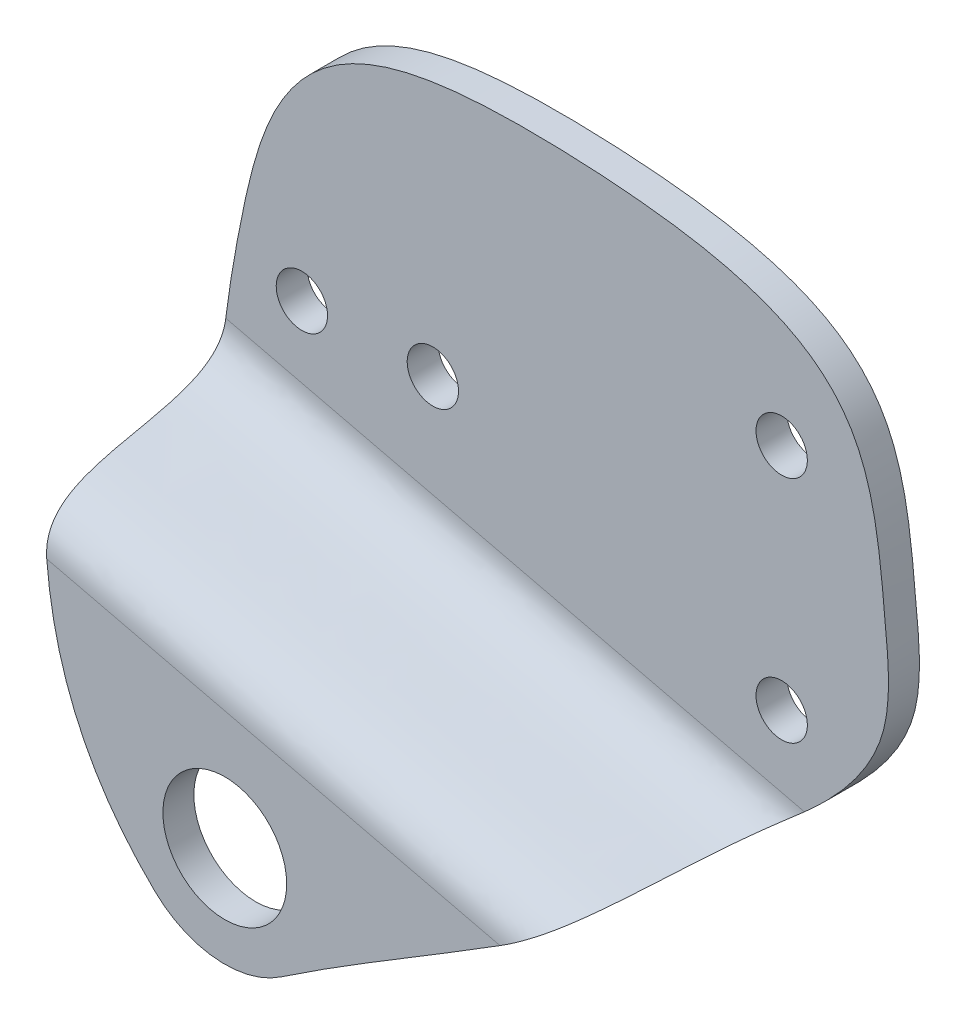
from build123d import *

# Parameters (mm, degrees)
MAIN_FEATURES_SKETCH_R   = 6
MAIN_FEATURES_SKETCH_R_2 = 2.4892
BOSS_EXTRUDE1_DEPTH      = 20
CUT_EXTRUDE1_DEPTH       = 81.169963393
CUT_EXTRUDE1_DEPTH_BACK  = 81.169963393


with BuildPart() as part:
    # main_features_sketch → Boss-Extrude1 (new body)
    with BuildSketch(Plane.XY):
        with BuildLine():
            ThreePointArc((-6.758273113, -14.327677037), (-0.830819524, -17.014537504), (5.466795464, -15.373205519))
            add(Edge.make_bspline(
                [(-6.758273113, -14.327677037), (-19.815407904, -1.771083652), (-17.868094073, 18.374574848), (-11.559395694, 47.113885006), (0.771302016, 51.653694953), (45.134222968, 49.048434389), (46.011316289, 37.291135993), (48.846230439, 7.873087579), (21.98254038, -4.189519042), (5.466795464, -15.373205519)],
                knots=[0, 0, 0, 0, 0.179468051, 0.221834172, 0.401235983, 0.455769682, 0.712637465, 0.770271344, 1, 1, 1, 1], degree=3))
        make_face()
        with Locations((0, -7.3)):
            Circle(MAIN_FEATURES_SKETCH_R, mode=Mode.SUBTRACT)
        with Locations((3.175, 25.4)):
            Circle(MAIN_FEATURES_SKETCH_R_2, mode=Mode.SUBTRACT)
        with Locations((37, 36.5125)):
            Circle(MAIN_FEATURES_SKETCH_R_2, mode=Mode.SUBTRACT)
        with Locations((37, 14.2875)):
            Circle(MAIN_FEATURES_SKETCH_R_2, mode=Mode.SUBTRACT)
        with Locations((-9.525, 25.4)):
            Circle(MAIN_FEATURES_SKETCH_R_2, mode=Mode.SUBTRACT)
    extrude(amount=BOSS_EXTRUDE1_DEPTH)

    # Sketch2 → Cut-Extrude1 (cut, two sides: drawn at the far end of the back side and taken through both)
    with BuildSketch(Plane(origin=(-12.676008996, 1.492836838, 0), x_dir=(0, 0, -1), z_dir=(0.9726405373904968, -0.23231527075232386, 0)).offset(-CUT_EXTRUDE1_DEPTH_BACK)):
        with BuildLine():
            Line((-3, 17.267886161), (-3, 56.346373374))
            Line((-3, 56.346373374), (-20, 56.346373374))
            Line((-20, 56.346373374), (-20, 5.61289325))
            add(Edge.make_bspline(
                [(-3, 17.267886161), (-3, 9.58747876), (-20, 13.827131116), (-20, 5.61289325)],
                knots=[0, 0, 0, 0, 1, 1, 1, 1], degree=3))
        make_face()
        with BuildLine():
            Line((0, -15.357439085), (0, 15.460949335))
            add(Edge.make_bspline(
                [(0, 15.460949335), (0, 9.016747051), (-17, 7.038917007), (-17, 4.540018839)],
                knots=[0, 0, 0, 0, 1, 1, 1, 1], degree=3))
            Line((-17, 4.540018839), (-17, -15.357439085))
            Line((-17, -15.357439085), (0, -15.357439085))
        make_face()
    extrude(amount=CUT_EXTRUDE1_DEPTH + CUT_EXTRUDE1_DEPTH_BACK, mode=Mode.SUBTRACT)


solid = part.part
